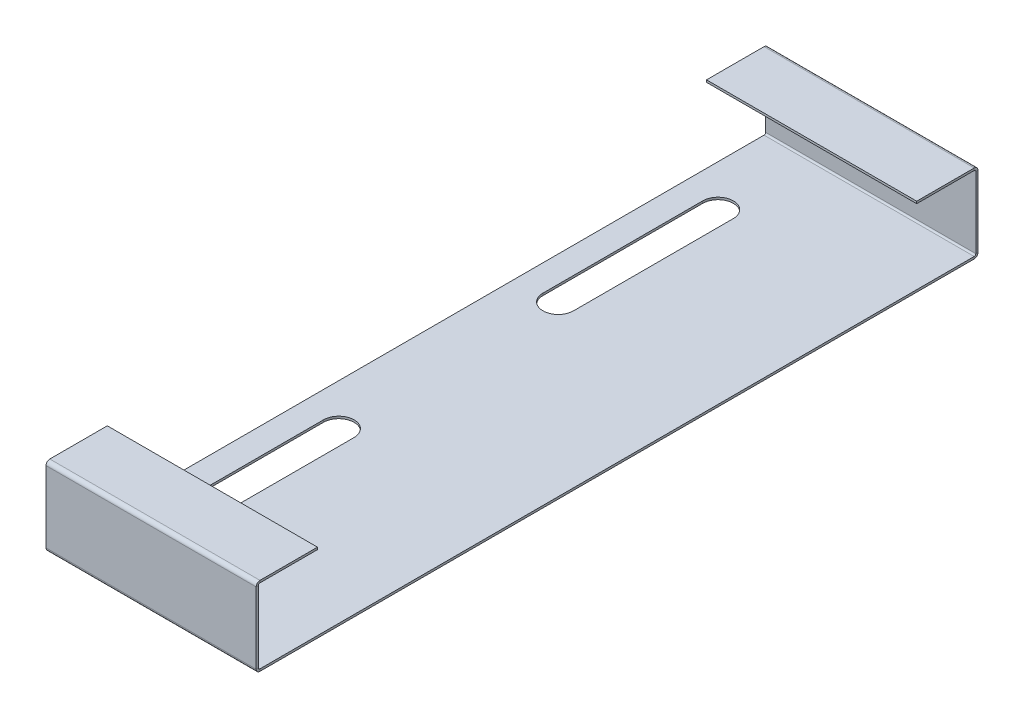
from build123d import *

# Parameters (mm, degrees)
SKETCH1_W                    = 96
SKETCH1_H                    = 1
BASE_FLANGE1_DEPTH           = 329.72
EDGE_FLANGE1_STRIP_W         = 5.4732
EDGE_FLANGE1_STRIP_H         = 1
EDGE_FLANGE1_STRIP_CUT_DEPTH = 96
EDGE_FLANGE1_DEPTH           = 96
EDGE_FLANGE2_STRIP_W         = 5.4732
EDGE_FLANGE2_STRIP_H         = 1
EDGE_FLANGE2_STRIP_CUT_DEPTH = 96
EDGE_FLANGE2_DEPTH           = 96
EDGE_FLANGE3_STRIP_W         = 5.4732
EDGE_FLANGE3_STRIP_H         = 1
EDGE_FLANGE3_STRIP_CUT_DEPTH = 96
EDGE_FLANGE3_DEPTH           = 96
EDGE_FLANGE4_STRIP_W         = 5.4732
EDGE_FLANGE4_STRIP_H         = 1
EDGE_FLANGE4_STRIP_CUT_DEPTH = 96
EDGE_FLANGE4_DEPTH           = 96
CUT_EXTRUDE1_DEPTH           = 10


# Sheet-metal steps are written as plain solids
with BuildPart() as part:
    # Sketch1 → Base-Flange1 (new body)
    with BuildSketch(Plane.XY):
        with Locations((48, -0.5)):
            Rectangle(SKETCH1_W, SKETCH1_H)
    extrude(amount=BASE_FLANGE1_DEPTH)

    # Edge-Flange1 strip (across the edge) → Edge-Flange1 strip cut (cut)
    with BuildSketch(Plane(origin=(0, 0, 329.72), x_dir=(0, 0, -1), z_dir=(1, 0, 0))):
        with Locations((-1, -0.5)):
            Rectangle(EDGE_FLANGE1_STRIP_W, EDGE_FLANGE1_STRIP_H)
    extrude(amount=EDGE_FLANGE1_STRIP_CUT_DEPTH, mode=Mode.SUBTRACT)

    # Edge-Flange1 section (across the edge) → Edge-Flange1 (add)
    with BuildSketch(Plane(origin=(0, 0, 329.72), x_dir=(0, 0, -1), z_dir=(1, 0, 0))):
        with BuildLine():
            Line((0, 0.7366), (0, 35))
            Line((0, 35), (1, 35))
            Line((1, 35), (1, 0.7366))
            ThreePointArc((1, 0.7366), (1.215745145, 0.215745145), (1.7366, 0))
            Line((1.7366, 0), (1.7366, -1))
            ThreePointArc((1.7366, -1), (0.508638364, -0.491361636), (0, 0.7366))
        make_face()
    extrude(amount=EDGE_FLANGE1_DEPTH)

    # Edge-Flange2 strip (across the edge) → Edge-Flange2 strip cut (cut)
    with BuildSketch(Plane.ZY.offset(-96)):
        with Locations((-1, -0.5)):
            Rectangle(EDGE_FLANGE2_STRIP_W, EDGE_FLANGE2_STRIP_H)
    extrude(amount=EDGE_FLANGE2_STRIP_CUT_DEPTH, mode=Mode.SUBTRACT)

    # Edge-Flange2 section (across the edge) → Edge-Flange2 (add)
    with BuildSketch(Plane.ZY.offset(-96)):
        with BuildLine():
            Line((0, 0.7366), (0, 35))
            Line((0, 35), (1, 35))
            Line((1, 35), (1, 0.7366))
            ThreePointArc((1, 0.7366), (1.215745145, 0.215745145), (1.7366, 0))
            Line((1.7366, 0), (1.7366, -1))
            ThreePointArc((1.7366, -1), (0.508638364, -0.491361636), (0, 0.7366))
        make_face()
    extrude(amount=EDGE_FLANGE2_DEPTH)

    # Edge-Flange3 strip (across the edge) → Edge-Flange3 strip cut (cut)
    with BuildSketch(Plane(origin=(0, 35, 328.72), x_dir=(0, -1, 0), z_dir=(1, 0, 0))):
        with Locations((-1, -0.5)):
            Rectangle(EDGE_FLANGE3_STRIP_W, EDGE_FLANGE3_STRIP_H)
    extrude(amount=EDGE_FLANGE3_STRIP_CUT_DEPTH, mode=Mode.SUBTRACT)

    # Edge-Flange3 section (across the edge) → Edge-Flange3 (add)
    with BuildSketch(Plane(origin=(0, 35, 328.72), x_dir=(0, -1, 0), z_dir=(1, 0, 0))):
        with BuildLine():
            Line((0, 0.7366), (0, 27))
            Line((0, 27), (1, 27))
            Line((1, 27), (1, 0.7366))
            ThreePointArc((1, 0.7366), (1.215745145, 0.215745145), (1.7366, 0))
            Line((1.7366, 0), (1.7366, -1))
            ThreePointArc((1.7366, -1), (0.508638364, -0.491361636), (0, 0.7366))
        make_face()
    extrude(amount=EDGE_FLANGE3_DEPTH)

    # Edge-Flange4 strip (across the edge) → Edge-Flange4 strip cut (cut)
    with BuildSketch(Plane(origin=(96, 35, 1), x_dir=(0, -1, 0), z_dir=(-1, 0, 0))):
        with Locations((-1, -0.5)):
            Rectangle(EDGE_FLANGE4_STRIP_W, EDGE_FLANGE4_STRIP_H)
    extrude(amount=EDGE_FLANGE4_STRIP_CUT_DEPTH, mode=Mode.SUBTRACT)

    # Edge-Flange4 section (across the edge) → Edge-Flange4 (add)
    with BuildSketch(Plane(origin=(96, 35, 1), x_dir=(0, -1, 0), z_dir=(-1, 0, 0))):
        with BuildLine():
            Line((0, 0.7366), (0, 27))
            Line((0, 27), (1, 27))
            Line((1, 27), (1, 0.7366))
            ThreePointArc((1, 0.7366), (1.215745145, 0.215745145), (1.7366, 0))
            Line((1.7366, 0), (1.7366, -1))
            ThreePointArc((1.7366, -1), (0.508638364, -0.491361636), (0, 0.7366))
        make_face()
    extrude(amount=EDGE_FLANGE4_DEPTH)

    # Sketch22 → Cut-Extrude1 (cut)
    with BuildSketch(Plane(origin=(0, 0, 0), x_dir=(1, 0, 0), z_dir=(0, 1, 0))):
        with BuildLine():
            Line((26, -214.9834), (26, -287.9834))
            ThreePointArc((26, -287.9834), (19, -294.9834), (12, -287.9834))
            Line((12, -287.9834), (12, -214.9834))
            ThreePointArc((12, -214.9834), (19, -207.9834), (26, -214.9834))
        make_face()
        with BuildLine():
            Line((26, -114.7366), (26, -41.7366))
            ThreePointArc((26, -41.7366), (19, -34.7366), (12, -41.7366))
            Line((12, -41.7366), (12, -114.7366))
            ThreePointArc((12, -114.7366), (19, -121.7366), (26, -114.7366))
        make_face()
    extrude(amount=-CUT_EXTRUDE1_DEPTH, mode=Mode.SUBTRACT)


solid = part.part
